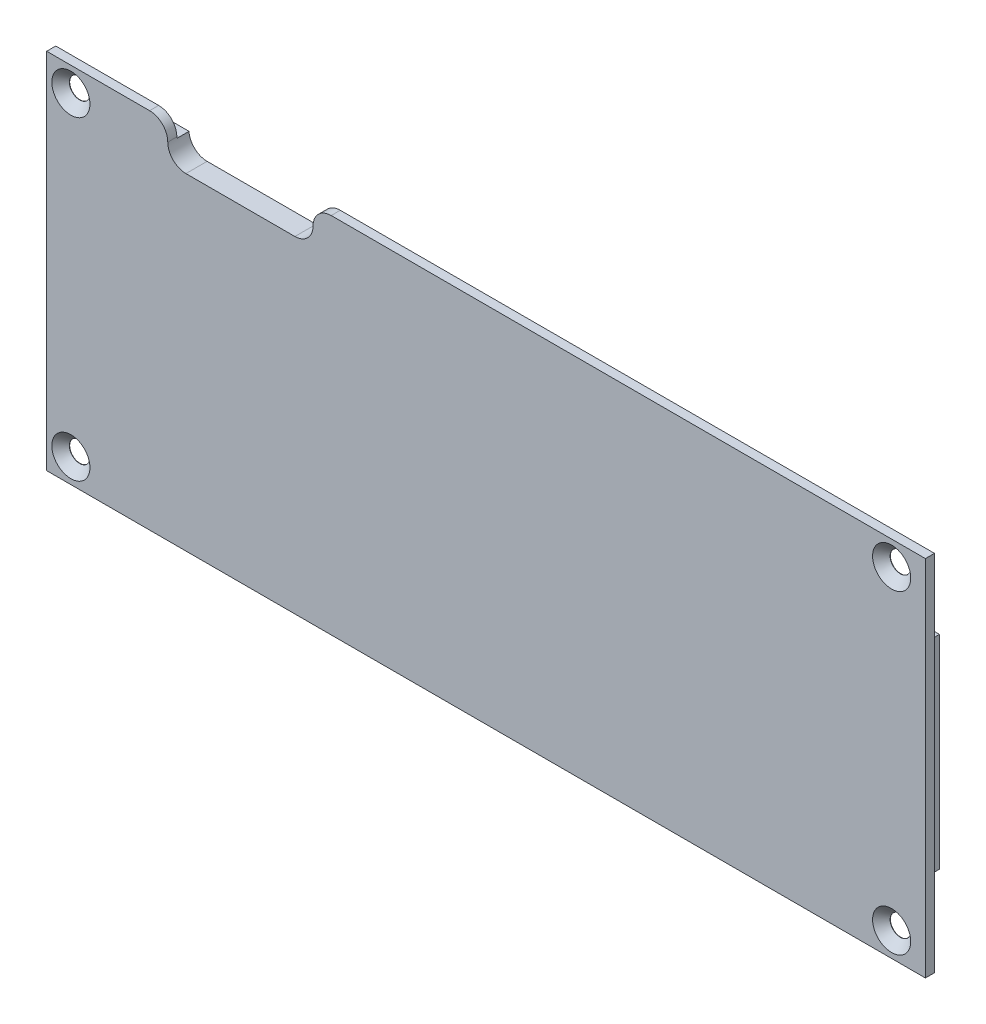
from build123d import *

# Parameters (mm, degrees)
ESQUISSE1_W                                 = 145.148196
ESQUISSE1_H                                 = 60
BOSS_EXTRU_1_DEPTH                          = 1.5
BOSS_EXTRU_2_DEPTH                          = 2
FRAISAGE_POUR_VIS_T_TE_FRAIS_E_M31_AT_COUNT = 2
FRAISAGE_POUR_VIS_T_TE_FRAIS_E_M31_AT_PITCH = 52
FRAISAGE_POUR_VIS_T_TE_FRAIS_E_M31_2_COUNT  = 2
FRAISAGE_POUR_VIS_T_TE_FRAIS_E_M31_2_PITCH  = 135.572178
FRAISAGE_POUR_VIS_T_TE_FRAIS_E_M31_3_COUNT  = 2
FRAISAGE_POUR_VIS_T_TE_FRAIS_E_M31_3_PITCH  = 145.20267025
ENL_V_MAT_EXTRU_1_DEPTH                     = 79.608203774
ENL_V_MAT_EXTRU_1_DEPTH_BACK                = 79.608203774
ESQUISSE6_W                                 = 24
ESQUISSE6_H                                 = 6
CONG_1_R                                    = 3
ESQUISSE7_W                                 = 45
ESQUISSE7_H                                 = 40
ENL_V_MAT_EXTRU_2_DEPTH                     = 2


with BuildPart() as part:
    # Esquisse1 → Boss.-Extru.1 (new body)
    with BuildSketch(Plane.XY):
        Rectangle(ESQUISSE1_W, ESQUISSE1_H)
    extrude(amount=BOSS_EXTRU_1_DEPTH)

    # Esquisse2 → Boss.-Extru.2 (add)
    with BuildSketch(Plane(origin=(0, 0, 0), x_dir=(-1, 0, 0), z_dir=(0, 0, -1))):
        with BuildLine():
            Line((-71.374098, -16.8), (-71.374098, 16.8))
            ThreePointArc((-71.374098, 16.8), (-64.303030188, 19.728932188), (-61.374098, 26.8))
            Line((-61.374098, 26.8), (61.374098, 26.8))
            ThreePointArc((61.374098, 26.8), (64.303030188, 19.728932188), (71.374098, 16.8))
            Line((71.374098, 16.8), (71.374098, -16.8))
            ThreePointArc((71.374098, -16.8), (64.303030188, -19.728932188), (61.374098, -26.8))
            Line((61.374098, -26.8), (-61.374098, -26.8))
            ThreePointArc((-61.374098, -26.8), (-64.303030188, -19.728932188), (-71.374098, -16.8))
        make_face()
    extrude(amount=BOSS_EXTRU_2_DEPTH)

    # Esquisse5 → Fraisage pour vis à tête fraisée M31 (revolve, cut)
    with BuildSketch(Plane(origin=(-68.574098, 26, 1.5), x_dir=(0, -1, 0), z_dir=(1, 0, 0))):
        Polygon((0, 0), (0, 1.5), (1.7, 1.5), (1.7, 1.45), (3.15, 0), align=None)
    fraisage_pour_vis_t_te_frais_e_m31 = revolve(axis=Axis((-68.574098, 26, 7.85), (0, 0, -1)), mode=Mode.SUBTRACT)

    # Fraisage pour vis à tête fraisée M31 at: Fraisage pour vis à tête fraisée M31 ×2
    with Locations(*[(0, -i * FRAISAGE_POUR_VIS_T_TE_FRAIS_E_M31_AT_PITCH, 0) for i in range(1, FRAISAGE_POUR_VIS_T_TE_FRAIS_E_M31_AT_COUNT)]):
        add(fraisage_pour_vis_t_te_frais_e_m31, mode=Mode.SUBTRACT)

    # Fraisage pour vis _ t_te frais_e M31 2: Fraisage pour vis à tête fraisée M31 ×2
    with Locations(*[(i * FRAISAGE_POUR_VIS_T_TE_FRAIS_E_M31_2_PITCH, 0, 0) for i in range(1, FRAISAGE_POUR_VIS_T_TE_FRAIS_E_M31_2_COUNT)]):
        add(fraisage_pour_vis_t_te_frais_e_m31, mode=Mode.SUBTRACT)

    # Fraisage pour vis _ t_te frais_e M31 3: Fraisage pour vis à tête fraisée M31 ×2
    with Locations(*[Vector(0.9336755155176905, -0.35812013588009123, 0) * (i * FRAISAGE_POUR_VIS_T_TE_FRAIS_E_M31_3_PITCH) for i in range(1, FRAISAGE_POUR_VIS_T_TE_FRAIS_E_M31_3_COUNT)]):
        add(fraisage_pour_vis_t_te_frais_e_m31, mode=Mode.SUBTRACT)

    # Esquisse6 → Enlèv. mat.-Extru.1 (cut, two sides: drawn at the far end of the back side and taken through both)
    with BuildSketch(Plane.XY.offset(1.5).offset(-ENL_V_MAT_EXTRU_1_DEPTH_BACK)):
        with Locations((-40.574098, 27)):
            Rectangle(ESQUISSE6_W, ESQUISSE6_H)
    extrude(amount=ENL_V_MAT_EXTRU_1_DEPTH + ENL_V_MAT_EXTRU_1_DEPTH_BACK, mode=Mode.SUBTRACT)

    # Congé1
    cong_1_edges = [part.edges().sort_by_distance(p)[0] for p in [
        (-28.574098, 30, 0.75),
        (-28.574098, 24, -0.25),
        (-52.574098, 30, 0.75),
        (-52.574098, 24, -0.25),
    ]]
    fillet(cong_1_edges, radius=CONG_1_R - 0.0001)  # a hair under: the kernel refuses the full size

    # Esquisse7 → Enlèv. mat.-Extru.2 (cut)
    with BuildSketch(Plane(origin=(0, 0, -2), x_dir=(-1, 0, 0), z_dir=(0, 0, -1))):
        with Locations((-13.455902, 6.8)):
            Rectangle(ESQUISSE7_W, ESQUISSE7_H)
    extrude(amount=-ENL_V_MAT_EXTRU_2_DEPTH, mode=Mode.SUBTRACT)


solid = part.part
